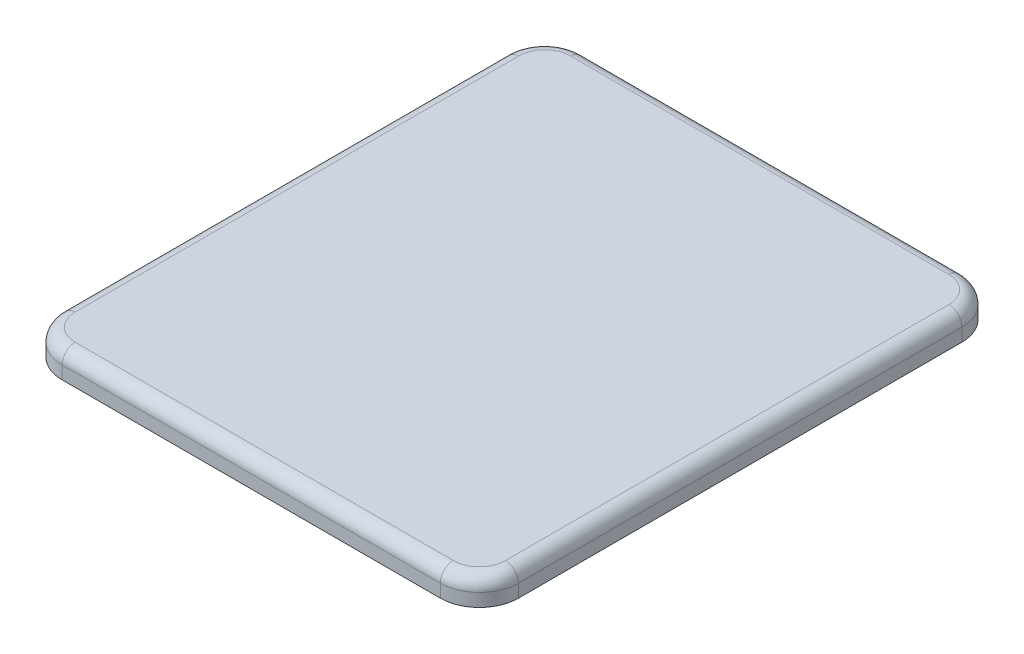
from build123d import *

# Parameters (mm, degrees)
BOSS_EXTRUDE1_DEPTH = 20
FILLET1_R           = 10


with BuildPart() as part:
    # Sketch1 → Boss-Extrude1 (new body)
    with BuildSketch(Plane(origin=(0, 0, 0), x_dir=(1, 0, 0), z_dir=(0, 1, 0))):
        with BuildLine():
            Line((-145, -200), (145, -200))
            ThreePointArc((145, -200), (166.213203436, -191.213203436), (175, -170))
            Line((175, -170), (175, 170))
            ThreePointArc((175, 170), (166.213203436, 191.213203436), (145, 200))
            Line((145, 200), (-145, 200))
            ThreePointArc((-145, 200), (-166.213203436, 191.213203436), (-175, 170))
            Line((-175, 170), (-175, -170))
            ThreePointArc((-175, -170), (-166.213203436, -191.213203436), (-145, -200))
        make_face()
    extrude(amount=BOSS_EXTRUDE1_DEPTH)

    # Fillet1
    fillet1_edges = [part.edges().sort_by_distance(p)[0] for p in [
        (-175, 20, 0),
        (-166.213203436, 20, -191.213203436),
        (0, 20, -200),
        (166.213203436, 20, -191.213203436),
        (175, 20, 0),
        (166.213203436, 20, 191.213203436),
        (0, 20, 200),
        (-166.213203436, 20, 191.213203436),
    ]]
    fillet(fillet1_edges, radius=FILLET1_R)


solid = part.part
